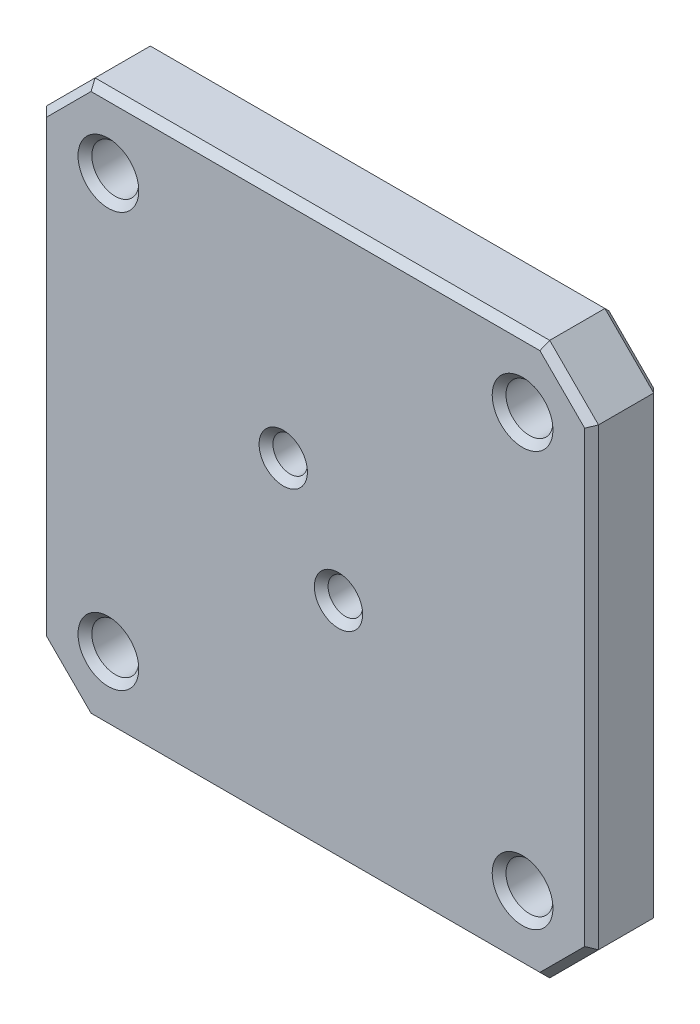
from build123d import *

# Parameters (mm, degrees)
SKETCH1_W           = 40
SKETCH1_H           = 40
BOSS_EXTRUDE1_DEPTH = 5
SKETCH2_R           = 1.7
CUT_EXTRUDE1_DEPTH  = 5
SKETCH3_R           = 1.25
CUT_EXTRUDE2_DEPTH  = 5
CHAMFER1_SIZE       = 3.536
CHAMFER2_SIZE       = 0.5


with BuildPart() as part:
    # Sketch1 → Boss-Extrude1 (new body)
    with BuildSketch(Plane.XY):
        with Locations((20, 20)):
            Rectangle(SKETCH1_W, SKETCH1_H)
    extrude(amount=BOSS_EXTRUDE1_DEPTH)

    # Sketch2 → Cut-Extrude1 (cut)
    with BuildSketch(Plane.XY.offset(5)):
        with Locations((5, 35)):
            Circle(SKETCH2_R)
        with Locations((35, 35)):
            Circle(SKETCH2_R)
        with Locations((5, 5)):
            Circle(SKETCH2_R)
        with Locations((35, 5)):
            Circle(SKETCH2_R)
    extrude(amount=-CUT_EXTRUDE1_DEPTH, mode=Mode.SUBTRACT)

    # Sketch3 → Cut-Extrude2 (cut)
    with BuildSketch(Plane.XY.offset(5)):
        with Locations((17.66557685, 23.464101615)):
            Circle(SKETCH3_R)
        with Locations((21.66557685, 16.535898385)):
            Circle(SKETCH3_R)
    extrude(amount=-CUT_EXTRUDE2_DEPTH, mode=Mode.SUBTRACT)

    # Chamfer1
    chamfer1_edges = [part.edges().sort_by_distance(p)[0] for p in [
        (0, 40, 2.5),
        (40, 40, 2.5),
        (40, 0, 2.5),
        (0, 0, 2.5),
    ]]
    chamfer(chamfer1_edges, length=CHAMFER1_SIZE)

    # Chamfer2
    chamfer2_edges = [part.edges().sort_by_distance(p)[0] for p in [
        (1.768, 1.768, 0),
        (20, 0, 0),
        (38.232, 1.768, 0),
        (40, 20, 0),
        (38.232, 38.232, 0),
        (20, 40, 0),
        (1.768, 38.232, 0),
        (0, 20, 0),
        (3.3, 35, 0),
        (33.3, 5, 0),
        (3.3, 5, 0),
        (33.3, 35, 0),
        (20.41557685, 16.535898385, 0),
        (16.41557685, 23.464101615, 0),
        (38.232, 38.232, 5),
        (40, 20, 5),
        (38.232, 1.768, 5),
        (20, 0, 5),
        (1.768, 1.768, 5),
        (0, 20, 5),
        (1.768, 38.232, 5),
        (20, 40, 5),
        (3.3, 35, 5),
        (33.3, 5, 5),
        (3.3, 5, 5),
        (33.3, 35, 5),
        (20.41557685, 16.535898385, 5),
        (16.41557685, 23.464101615, 5),
    ]]
    chamfer(chamfer2_edges, length=CHAMFER2_SIZE)


solid = part.part
